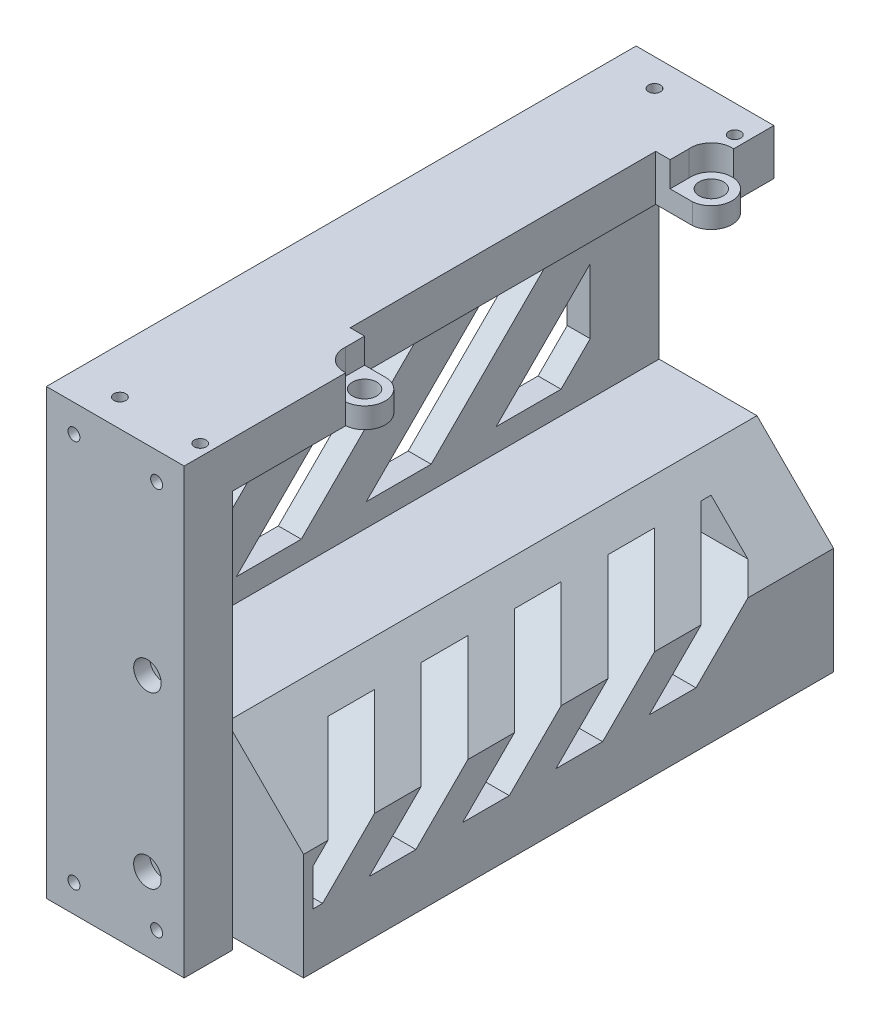
from build123d import *

# Parameters (mm, degrees)
SKETCH1_W                = 25
SKETCH1_H                = 96.550841869
SKETCH1_R                = 1.49999954
BOSS_EXTRUDE1_DEPTH      = 10.5
BOSS_EXTRUDE2_DEPTH      = 10
SKETCH3_W                = 128.414742868
SKETCH3_H                = 96.550841869
BOSS_EXTRUDE3_DEPTH      = 5
SKETCH4_W                = 115.414742868
SKETCH4_H                = 50
BOSS_EXTRUDE4_DEPTH      = 55
CHAMFER1_START           = -252
CHAMFER1_OUTLINE_W       = 34
CHAMFER1_OUTLINE_H       = 38
CHAMFER1_DEPTH           = 15.365787816
CUT_EXTRUDE2_DEPTH       = 35
CUT_EXTRUDE3_DEPTH       = 35
SKETCH8_W                = 15
SKETCH8_H                = 115.414742868
CUT_EXTRUDE4_DEPTH       = 63
BOSS_EXTRUDE5_DEPTH      = 98.414743
SHELL4_START             = -109.914742868
SHELL4_DEPTH             = 99.414742868
CUT_EXTRUDE5_DEPTH       = 109
CUT_EXTRUDE5_DEPTH_BACK  = 63
SKETCH11_W               = 123.799360138
SKETCH11_H               = 33.831056374
CUT_EXTRUDE6_DEPTH       = 26
SKETCH12_W               = 29.269926363
SKETCH12_H               = 164.43485677
CUT_EXTRUDE7_DEPTH       = 10
SKETCH13_R               = 4.5
SKETCH13_R_2             = 2.65
BOSS_EXTRUDE6_DEPTH      = 10.000001
SKETCH15_W               = 8
SKETCH15_H               = 66.531655037
CUT_EXTRUDE8_DEPTH       = 10.5
SKETCH16_R               = 4.5
CUT_EXTRUDE9_DEPTH       = 5.5
SKETCH17_R               = 3
CUT_EXTRUDE10_DEPTH      = 3.5
SKETCH18_R               = 1.3
CUT_EXTRUDE11_DEPTH      = 12
SKETCH19_R               = 1.3
CUT_EXTRUDE12_DEPTH      = 12
CUT_EXTRUDE13_START      = -12
SKETCH20_R               = 1.3
CUT_EXTRUDE13_DEPTH      = 12
CUT_EXTRUDE14_START      = -12
SKETCH21_R               = 1.3
CUT_EXTRUDE14_DEPTH      = 12
SKETCH22_R               = 1.3
CUT_EXTRUDE15_DEPTH      = 12
CUT_EXTRUDE16_DEPTH      = 76
CUT_EXTRUDE16_DEPTH_BACK = 10
CUT_EXTRUDE17_DEPTH      = 52
SKETCH26_W               = 34.730533978
SKETCH26_H               = 76.243650472
CUT_EXTRUDE18_DEPTH      = 5.5


with BuildPart() as part:
    # Sketch1 → Boss-Extrude1 (new body)
    with BuildSketch(Plane.XY):
        with Locations((-810.97776474, 559.805450232)):
            Rectangle(SKETCH1_W, SKETCH1_H)
        with Locations(Location((-806.47776728, 564.59342504, 0), (0, 0, 180))):
            Circle(SKETCH1_R, mode=Mode.SUBTRACT)
        with BuildLine():
            ThreePointArc((-806.268846123, 529.078804669), (-807.963945033, 527.797615779), (-806.677186094, 526.106741236))
            ThreePointArc((-806.677186094, 526.106741236), (-804.991725437, 527.389254352), (-806.268846123, 529.078804669))
        make_face(mode=Mode.SUBTRACT)
    extrude(amount=BOSS_EXTRUDE1_DEPTH)

    # Sketch2 → Boss-Extrude2 (add)
    with BuildSketch(Plane(origin=(0, 608.080871166, 0), x_dir=(1, 0, 0), z_dir=(0, 1, 0))):
        with BuildLine():
            Line((-798.47776474, -10.5), (-823.47776474, -10.5))
            Line((-823.47776474, -10.5), (-823.47776474, 117.914742868))
            Line((-823.47776474, 117.914742868), (-798.47776474, 117.914742868))
            Line((-798.47776474, 117.914742868), (-798.47776474, 107.638590369))
            add(Edge.make_bspline(
                [(-798.47776474, 107.638590369), (-798.605500873, 107.654795501), (-798.731604956, 107.662446126), (-798.855368664, 107.662444566), (-804.855368663, 107.662368913), (-804.85529301, 101.662368914), (-798.855293011, 101.662444566), (-798.731553588, 101.662446127), (-798.605474859, 101.670096932), (-798.47776474, 101.686298763)],
                knots=[0.970284955, 0.970284955, 0.970284955, 0.970284955, 1, 1, 1, 1.5, 1.5, 1.5, 1.529709446, 1.529709446, 1.529709446, 1.529709446], degree=3, weights=[0.88820369, 0.923114503, 0.960379939, 1, 0.333333333, 0.333333333, 1, 0.960387406, 0.923128548, 0.888223426]))
            Line((-798.47776474, 101.686298763), (-798.47776474, 32.138710991))
            add(Edge.make_bspline(
                [(-798.47776474, 32.138710991), (-798.605176086, 32.154833511), (-798.730961028, 32.162446129), (-798.854416698, 32.162444572), (-804.854416698, 32.162368919), (-804.854341045, 26.16236892), (-798.854341045, 26.162444572), (-798.730909662, 26.162446129), (-798.605150073, 26.170058925), (-798.47776474, 26.186178153)],
                knots=[0.970355989, 0.970355989, 0.970355989, 0.970355989, 1, 1, 1, 1.5, 1.5, 1.5, 1.529638409, 1.529638409, 1.529638409, 1.529638409], degree=3, weights=[0.888454097, 0.923292685, 0.960474653, 1, 0.333333333, 0.333333333, 1, 0.960482121, 0.923306736, 0.888473845]))
            Line((-798.47776474, 26.186178153), (-798.47776474, -10.5))
        make_face()
    extrude(amount=-BOSS_EXTRUDE2_DEPTH)

    # Sketch3 → Boss-Extrude3 (add)
    with BuildSketch(Plane.ZY.offset(823.47776474)):
        with Locations((-53.707371434, 559.805450232)):
            Rectangle(SKETCH3_W, SKETCH3_H)
    extrude(amount=BOSS_EXTRUDE3_DEPTH)

    # Sketch4 → Boss-Extrude4 (add)
    with BuildSketch(Plane(origin=(-823.47776474, 0, 0), x_dir=(0, 0, -1), z_dir=(1, 0, 0))):
        with Locations((60.207371434, 536.530029297)):
            Rectangle(SKETCH4_W, SKETCH4_H)
    extrude(amount=BOSS_EXTRUDE4_DEPTH)

    # Chamfer1: read off the stored shape, not the designer's step
    # Chamfer1 outline → Chamfer1 (cut)
    with BuildSketch(Plane(origin=(0, 0, 0), x_dir=(0.8164965809277258, -0.40824829046386313, -0.40824829046386313), z_dir=(0.5773502691896258, 0.5773502691896258, 0.5773502691896258)).offset(CHAMFER1_START)):
        with Locations((-832, 445)):
            Rectangle(CHAMFER1_OUTLINE_W, CHAMFER1_OUTLINE_H)
    extrude(amount=CHAMFER1_DEPTH, mode=Mode.SUBTRACT)

    # Sketch6 → Cut-Extrude2 (cut)
    with BuildSketch(Plane.XZ.offset(-511.530029297)):
        Polygon((-816.47776474, -4.5), (-816.47776474, -87.94418012), (-801.507201992, -102.914742868), (-793.47776474, -102.914742868), (-793.47776474, -4.5), align=None)
    extrude(amount=-CUT_EXTRUDE2_DEPTH, mode=Mode.SUBTRACT)

    # Sketch7 → Cut-Extrude3 (cut)
    with BuildSketch(Plane.ZY.offset(828.47776474)):
        Polygon((-102.914742868, 546.530029297), (-102.914742868, 538.500592045), (-87.94418012, 523.530029297), (-4.5, 523.530029297), (-4.5, 546.530029297), align=None)
    extrude(amount=-CUT_EXTRUDE3_DEPTH, mode=Mode.SUBTRACT)

    # Sketch8 → Cut-Extrude4 (cut)
    with BuildSketch(Plane.XZ.offset(-511.530029297)):
        with Locations((-775.97776474, -60.207371434)):
            Rectangle(SKETCH8_W, SKETCH8_H)
    extrude(amount=-CUT_EXTRUDE4_DEPTH, mode=Mode.SUBTRACT)

    # Sketch9 → Boss-Extrude5 (add)
    with BuildSketch(Plane(origin=(0, 0, -4.5), x_dir=(-1, 0, 0), z_dir=(0, 0, -1))):
        Polygon((793.47776474, 546.530029297), (808.47776474, 546.530029297), (793.47776474, 531.530029297), align=None)
    extrude(amount=BOSS_EXTRUDE5_DEPTH)

    # Shell4: read off the stored shape, not the designer's step
    # Shell4 outline → Shell4 (cut)
    with BuildSketch(Plane.XY.offset(SHELL4_START)):
        Polygon((-785.47776474, 534.843737796), (-785.47776474, 519.530029297), (-783.47776474, 519.530029297), (-783.47776474, 553.530029297), (-804.164056241, 553.530029297), align=None)
    extrude(amount=SHELL4_DEPTH, mode=Mode.SUBTRACT)

    # Sketch10 → Cut-Extrude5 (cut, two sides: drawn at the far end of the back side and taken through both)
    with BuildSketch(Plane.XY.offset(-109.914742868).offset(-CUT_EXTRUDE5_DEPTH_BACK)):
        Polygon((-783.47776474, 532.843737796), (-812.164056241, 561.530029297), (-783.47776474, 561.530029297), align=None)
    extrude(amount=CUT_EXTRUDE5_DEPTH + CUT_EXTRUDE5_DEPTH_BACK, mode=Mode.SUBTRACT)

    # Sketch11 → Cut-Extrude6 (cut)
    with BuildSketch(Plane(origin=(-785.47776474, 0, 0), x_dir=(0, 0, -1), z_dir=(1, 0, 0))):
        with Locations((63.745157391, 525.370267851)):
            Rectangle(SKETCH11_W, SKETCH11_H)
    extrude(amount=CUT_EXTRUDE6_DEPTH, mode=Mode.SUBTRACT)

    # Sketch12 → Cut-Extrude7 (cut)
    with BuildSketch(Plane(origin=(0, 561.530029297, 0), x_dir=(1, 0, 0), z_dir=(0, 1, 0))):
        with Locations((-808.842801559, 84.717428385)):
            Rectangle(SKETCH12_W, SKETCH12_H)
    extrude(amount=-CUT_EXTRUDE7_DEPTH, mode=Mode.SUBTRACT)

    # Sketch13 → Boss-Extrude6 (add)
    # profile 1 of 2: a face of its own
    with BuildSketch(Plane(origin=(0, 608.080871166, 0), x_dir=(1, 0, 0), z_dir=(0, 1, 0))):
        with Locations((-798.855330837, 104.662444566)):
            Circle(SKETCH13_R)
        with Locations(Location((-798.855330837, 104.662444566, 0), (0, 0, 270))):
            Circle(SKETCH13_R_2, mode=Mode.SUBTRACT)
    # profile 2 of 2: a face of its own
    with BuildSketch(Plane(origin=(0, 608.080871166, 0), x_dir=(1, 0, 0), z_dir=(0, 1, 0))):
        with Locations((-798.854378872, 29.162444572)):
            Circle(SKETCH13_R)
        with Locations(Location((-798.854378872, 29.162444572, 0), (0, 0, 270))):
            Circle(SKETCH13_R_2, mode=Mode.SUBTRACT)
    extrude(amount=-BOSS_EXTRUDE6_DEPTH)

    # Sketch15 → Cut-Extrude8 (cut)
    with BuildSketch(Plane(origin=(0, 608.080871166, 0), x_dir=(1, 0, 0), z_dir=(0, 1, 0))):
        with Locations((-802.47776474, 66.912484597)):
            Rectangle(SKETCH15_W, SKETCH15_H)
    extrude(amount=-CUT_EXTRUDE8_DEPTH, mode=Mode.SUBTRACT)

    # Sketch16 → Cut-Extrude9 (cut)
    with BuildSketch(Plane(origin=(0, 608.080871166, 0), x_dir=(1, 0, 0), z_dir=(0, 1, 0))):
        with Locations((-798.855330837, 104.662444566)):
            Circle(SKETCH16_R)
        with Locations((-798.854378872, 29.162444572)):
            Circle(SKETCH16_R)
    extrude(amount=-CUT_EXTRUDE9_DEPTH, mode=Mode.SUBTRACT)

    # Sketch17 → Cut-Extrude10 (cut)
    with BuildSketch(Plane.XY.offset(10.5)):
        with Locations((-806.47776728, 564.59342504)):
            Circle(SKETCH17_R)
        with Locations((-806.47776474, 527.59342538)):
            Circle(SKETCH17_R)
    extrude(amount=-CUT_EXTRUDE10_DEPTH, mode=Mode.SUBTRACT)

    # Sketch18 → Cut-Extrude11 (cut)
    with BuildSketch(Plane(origin=(0, 0, -117.914742868), x_dir=(-1, 0, 0), z_dir=(0, 0, -1))):
        with Locations((804.47776474, 602.080871166)):
            Circle(SKETCH18_R)
        with Locations((822.47776474, 602.080871166)):
            Circle(SKETCH18_R)
        with Locations((795.335629116, 517.530029297)):
            Circle(SKETCH18_R)
        with Locations((822.47776474, 544.672164921)):
            Circle(SKETCH18_R)
    extrude(amount=-CUT_EXTRUDE11_DEPTH, mode=Mode.SUBTRACT)

    # Sketch19 → Cut-Extrude12 (cut)
    with BuildSketch(Plane(origin=(0, 608.080871166, 0), x_dir=(1, 0, 0), z_dir=(0, 1, 0))):
        with Locations(Location((-800.992483366, 111.914742868, 0), (0, 0, 270))):
            Circle(SKETCH19_R)
        with Locations(Location((-818.47776474, 111.914742868, 0), (0, 0, 270))):
            Circle(SKETCH19_R)
        with Locations(Location((-800.992483366, -4.5, 0), (0, 0, 270))):
            Circle(SKETCH19_R)
        with Locations(Location((-818.47776474, -4.5, 0), (0, 0, 270))):
            Circle(SKETCH19_R)
    extrude(amount=-CUT_EXTRUDE12_DEPTH, mode=Mode.SUBTRACT)

    # Sketch20 → Cut-Extrude13 (cut)
    with BuildSketch(Plane.XY.offset(10.5).offset(CUT_EXTRUDE13_START)):
        with Locations(Location((-822.47776474, 602.080871166, 0), (0, 0, 180))):
            Circle(SKETCH20_R)
        with Locations(Location((-804.47776474, 602.080871166, 0), (0, 0, 180))):
            Circle(SKETCH20_R)
        with Locations((-822.47776474, 517.530029297)):
            Circle(SKETCH20_R)
        with Locations((-804.47776474, 517.530029297)):
            Circle(SKETCH20_R)
    extrude(amount=CUT_EXTRUDE13_DEPTH, mode=Mode.SUBTRACT)

    # Sketch21 → Cut-Extrude14 (cut)
    with BuildSketch(Plane.XZ.offset(-511.530029297).offset(CUT_EXTRUDE14_START)):
        with Locations(Location((-818.47776474, 4.5, 0), (0, 0, 90))):
            Circle(SKETCH21_R)
        with Locations(Location((-800.992483366, 4.5, 0), (0, 0, 90))):
            Circle(SKETCH21_R)
        with Locations(Location((-800.992483366, -111.914742868, 0), (0, 0, 90))):
            Circle(SKETCH21_R)
        with Locations(Location((-818.47776474, -94.429461494, 0), (0, 0, 270))):
            Circle(SKETCH21_R)
    extrude(amount=CUT_EXTRUDE14_DEPTH, mode=Mode.SUBTRACT)

    # Sketch22 → Cut-Extrude15 (cut)
    with BuildSketch(Plane.ZY.offset(828.47776474)):
        with Locations((-111.914742868, 602.080871166)):
            Circle(SKETCH22_R)
        with Locations((4.5, 602.080871166)):
            Circle(SKETCH22_R)
        with Locations((4.5, 517.530029297)):
            Circle(SKETCH22_R)
        with Locations((-90.429461494, 517.530029297)):
            Circle(SKETCH22_R)
        with Locations((-111.914742868, 539.015310671)):
            Circle(SKETCH22_R)
    extrude(amount=-CUT_EXTRUDE15_DEPTH, mode=Mode.SUBTRACT)

    # Sketch23 → Cut-Extrude16 (cut, two sides: drawn at the far end of the back side and taken through both)
    with BuildSketch(Plane.ZY.offset(793.47776474).offset(-CUT_EXTRUDE16_DEPTH_BACK)):
        Polygon((-24.798033275, 531.530029297), (-34.961768539, 531.530029297), (-26.961768539, 523.530029297), (-16.798033275, 523.530029297), align=None)
        Polygon((-4.5, 531.530029297), (-14.634298012, 531.530029297), (-6.634298012, 523.530029297), (-4.5, 523.530029297), align=None)
        Polygon((-29.634298012, 546.530029297), (-14.634298012, 531.530029297), (-4.5, 531.530029297), (-4.5, 531.559466548), (-19.470562748, 546.530029297), align=None)
        Polygon((-49.961768539, 546.530029297), (-34.961768539, 531.530029297), (-24.798033275, 531.530029297), (-39.798033275, 546.530029297), align=None)
        Polygon((-45.125503802, 531.530029297), (-55.289239066, 531.530029297), (-47.289239066, 523.530029297), (-37.125503802, 523.530029297), align=None)
        Polygon((-70.289239066, 546.530029297), (-55.289239066, 531.530029297), (-45.125503802, 531.530029297), (-60.125503802, 546.530029297), align=None)
        Polygon((-65.45297433, 531.530029297), (-75.616709593, 531.530029297), (-67.616709593, 523.530029297), (-57.45297433, 523.530029297), align=None)
        Polygon((-90.616709593, 546.530029297), (-75.616709593, 531.530029297), (-65.45297433, 531.530029297), (-80.45297433, 546.530029297), align=None)
        Polygon((-85.780444857, 531.530029297), (-95.94418012, 531.530029297), (-87.94418012, 523.530029297), (-77.780444857, 523.530029297), align=None)
        Polygon((-102.914742868, 546.530029297), (-102.914742868, 538.500592045), (-95.94418012, 531.530029297), (-85.780444857, 531.530029297), (-100.780444857, 546.530029297), align=None)
    extrude(amount=CUT_EXTRUDE16_DEPTH + CUT_EXTRUDE16_DEPTH_BACK, mode=Mode.SUBTRACT)

    # Sketch24 → Cut-Extrude17 (cut)
    with BuildSketch(Plane.ZY.offset(828.47776474)):
        Polygon((-95.692792369, 598.080871166), (-54.1419505, 556.530029297), (-68.2819505, 556.530029297), (-102.914742868, 591.162821666), (-102.914742868, 598.080871166), align=None)
        Polygon((-81.552792369, 598.080871166), (-40.0019505, 556.530029297), (-25.8619505, 556.530029297), (-67.412792369, 598.080871166), align=None)
        Polygon((-53.272792369, 598.080871166), (-11.7219505, 556.530029297), (-4.5, 556.530029297), (-4.5, 563.448078797), (-39.132792369, 598.080871166), align=None)
        Polygon((-24.992792369, 598.080871166), (-4.5, 577.588078797), (-4.5, 591.728078797), (-10.852792369, 598.080871166), align=None)
        Polygon((-96.5619505, 556.530029297), (-82.4219505, 556.530029297), (-102.914742868, 577.022821666), (-102.914742868, 562.882821666), align=None)
    extrude(amount=-CUT_EXTRUDE17_DEPTH, mode=Mode.SUBTRACT)

    # Sketch26 → Cut-Extrude18 (cut)
    with BuildSketch(Plane(origin=(0, 608.080871166, 0), x_dir=(1, 0, 0), z_dir=(0, 1, 0))):
        with Locations((-785.9741963, 66.918185427)):
            Rectangle(SKETCH26_W, SKETCH26_H)
    extrude(amount=-CUT_EXTRUDE18_DEPTH, mode=Mode.SUBTRACT)


solid = part.part
